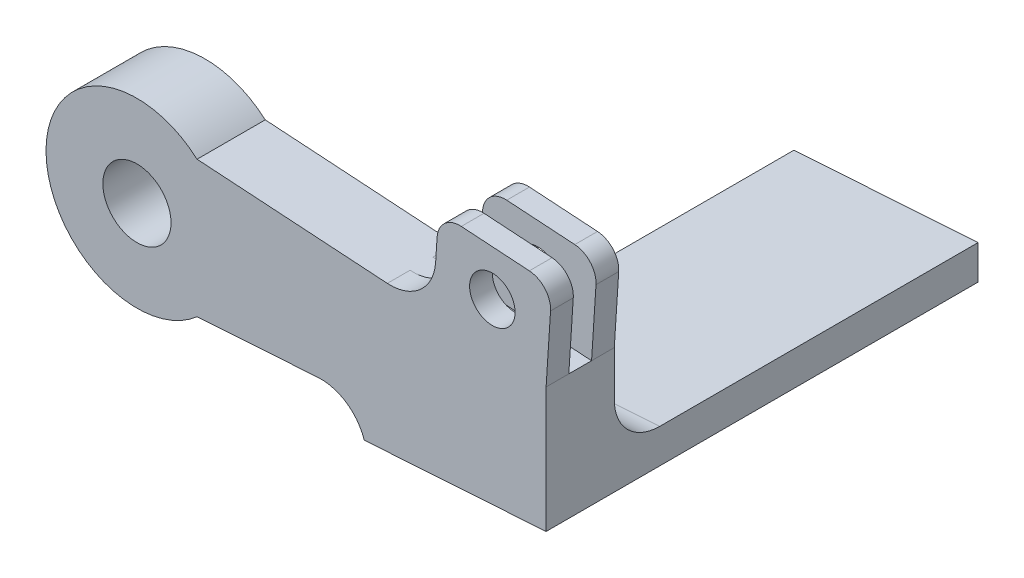
from build123d import *

# Parameters (mm, degrees)
SKETCH1_R                       = 20
SKETCH1_R_2                     = 7.5
BOSS_EXTRUDE1_DEPTH             = 7.5
BOSS_EXTRUDE2_DEPTH             = 7.5
SKETCH4_W                       = 25
SKETCH4_H                       = 5
BOSS_EXTRUDE3_DEPTH             = 20
SKETCH5_R                       = 5
CUT_EXTRUDE1_DEPTH              = 98.765588134
FILLET1_R                       = 5
FILLET2_R                       = 10
BOSS_EXTRUDE4_REACH             = 99.371
BOSS_EXTRUDE4_DIRECTION_2_DEPTH = 80
FILLET3_R                       = 10
FILLET4_R                       = 10


with BuildPart() as part:
    # Sketch1 → Boss-Extrude1 (new, symmetric)
    with BuildSketch(Plane.XY):
        Circle(SKETCH1_R)
        Circle(SKETCH1_R_2, mode=Mode.SUBTRACT)
    extrude(amount=BOSS_EXTRUDE1_DEPTH, both=True)

    # Sketch2 → Boss-Extrude2 (add, symmetric)
    with BuildSketch(Plane.XY):
        with BuildLine():
            Line((13.228756555, 15), (90, 10))
            Line((90, 10), (90, -10))
            Line((90, -10), (13.228756555, -15))
            ThreePointArc((13.228756555, -15), (20, 0), (13.228756555, 15))
        make_face()
    extrude(amount=BOSS_EXTRUDE2_DEPTH, both=True)

    # Sketch4 → Boss-Extrude3 (add)
    with BuildSketch(Plane(origin=(1.028677717, 15.794573482, 0), x_dir=(0.9978858591262095, -0.06499086209573432, 0), z_dir=(0.06499086209573432, 0.9978858591262095, 0))):
        with Locations((76.6598187, 5)):
            Rectangle(SKETCH4_W, SKETCH4_H)
        with Locations((76.6598187, -5)):
            Rectangle(SKETCH4_W, SKETCH4_H)
    extrude(amount=BOSS_EXTRUDE3_DEPTH)

    # Sketch5 → Cut-Extrude1 (cut, through all)
    with BuildSketch(Plane.XY.offset(7.5)):
        with Locations((78.176335382, 20.791244367)):
            Circle(SKETCH5_R)
    extrude(amount=-CUT_EXTRUDE1_DEPTH, mode=Mode.SUBTRACT)

    # Fillet1
    fillet1_edges = [part.edges().sort_by_distance(p)[0] for p in [
        (66.352670764, 31.582488735, -5),
        (91.299817242, 29.957717183, -5),
        (66.352670764, 31.582488735, 5),
        (91.299817242, 29.957717183, 5),
    ]]
    fillet(fillet1_edges, radius=FILLET1_R)

    # Fillet2
    fillet2_edges = [part.edges().sort_by_distance(p)[0] for p in [
        (65.052853522, 11.624771552, -5),
        (65.052853522, 11.624771552, 5),
    ]]
    fillet(fillet2_edges, radius=FILLET2_R)

    # Boss-Extrude4: up to this face of the body (flat: up to its plane)
    boss_extrude4_end = Plane(part.part.faces().sort_by_distance((38.09502008, 2.657537248, 7.5))[0])
    # Sketch6 → Boss-Extrude4 (add, up to the picked face)
    with BuildSketch(Plane(origin=(0, 0, -7.5), x_dir=(-1, 0, 0), z_dir=(0, 0, -1)), mode=Mode.PRIVATE) as boss_extrude4_sk1:
        Polygon((-90, -10), (-90, -17.531812963), (-50, -20.136955084), (-49.511535852, -12.636955084), align=None)
    boss_extrude4_tool1 = split(extrude(boss_extrude4_sk1.sketch, amount=-BOSS_EXTRUDE4_REACH, mode=Mode.PRIVATE), bisect_by=boss_extrude4_end, keep=Keep.BOTH, mode=Mode.PRIVATE)
    add(boss_extrude4_tool1.solids().sort_by(Axis((69.877637, -15.068829, -7.5), (0, 0, 1)))[0])

    # Sketch6 → Boss-Extrude4 direction 2 (add)
    with BuildSketch(Plane(origin=(0, 0, -7.5), x_dir=(-1, 0, 0), z_dir=(0, 0, -1))):
        Polygon((-90, -10), (-90, -17.531812963), (-50, -20.136955084), (-49.511535852, -12.636955084), align=None)
    extrude(amount=BOSS_EXTRUDE4_DIRECTION_2_DEPTH)

    # Fillet3
    # the kernel refuses this fillet: 10 mm, written as the material it adds along each edge
    with BuildSketch(Plane(origin=(49.511535852, -12.636955084, -7.5), x_dir=(0.06499086209573703, -0.9978858591262094, 0), z_dir=(0, 0, 1))) as fillet3_piece_1:
        with BuildLine():
            CenterArc((10, -9.686547154), FILLET3_R, 104.383505331, 75.616494669)
            Line((0, -9.686547154), (0, 0))
            Line((0, 0), (7.51588965, 0))
        make_face()
    extrude(amount=15)

    # Fillet4
    fillet4_edges = [part.edges().sort_by_distance(p)[0] for p in [
        (69.755767926, -11.318477542, -7.5),
    ]]
    fillet(fillet4_edges, radius=FILLET4_R)


solid = part.part
